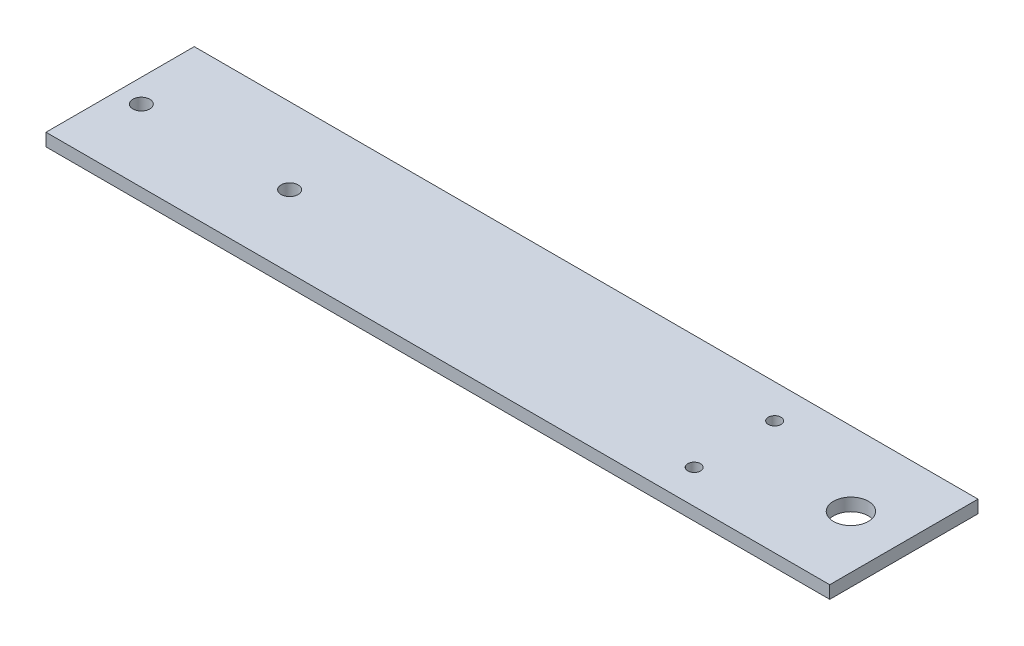
from build123d import *

# Parameters (mm, degrees)
SKETCH1_W           = 185
SKETCH1_H           = 35
SKETCH1_R           = 4.125
BOSS_EXTRUDE1_DEPTH = 3
SKETCH2_R           = 2
CUT_EXTRUDE1_DEPTH  = 95.188640504
SKETCH4_R           = 1.5
CUT_EXTRUDE3_DEPTH  = 95.188640504


with BuildPart() as part:
    # Sketch1 → Boss-Extrude1 (new body)
    with BuildSketch(Plane(origin=(0, 0, 0), x_dir=(1, 0, 0), z_dir=(0, 1, 0))):
        Rectangle(SKETCH1_W, SKETCH1_H)
        with Locations((80, 0)):
            Circle(SKETCH1_R, mode=Mode.SUBTRACT)
    extrude(amount=BOSS_EXTRUDE1_DEPTH)

    # Sketch2 → Cut-Extrude1 (cut, through all)
    with BuildSketch(Plane(origin=(0, 3, 0), x_dir=(1, 0, 0), z_dir=(0, 1, 0))):
        with Locations((-87, -0.5)):
            Circle(SKETCH2_R)
        with Locations((-52, -0.5)):
            Circle(SKETCH2_R)
    extrude(amount=-CUT_EXTRUDE1_DEPTH, mode=Mode.SUBTRACT)

    # Sketch4 → Cut-Extrude3 (cut, through all)
    with BuildSketch(Plane(origin=(0, 3, 0), x_dir=(1, 0, 0), z_dir=(0, 1, 0))):
        with Locations((52.5, 9.5)):
            Circle(SKETCH4_R)
        with Locations((52.5, -9.5)):
            Circle(SKETCH4_R)
    extrude(amount=-CUT_EXTRUDE3_DEPTH, mode=Mode.SUBTRACT)


solid = part.part
